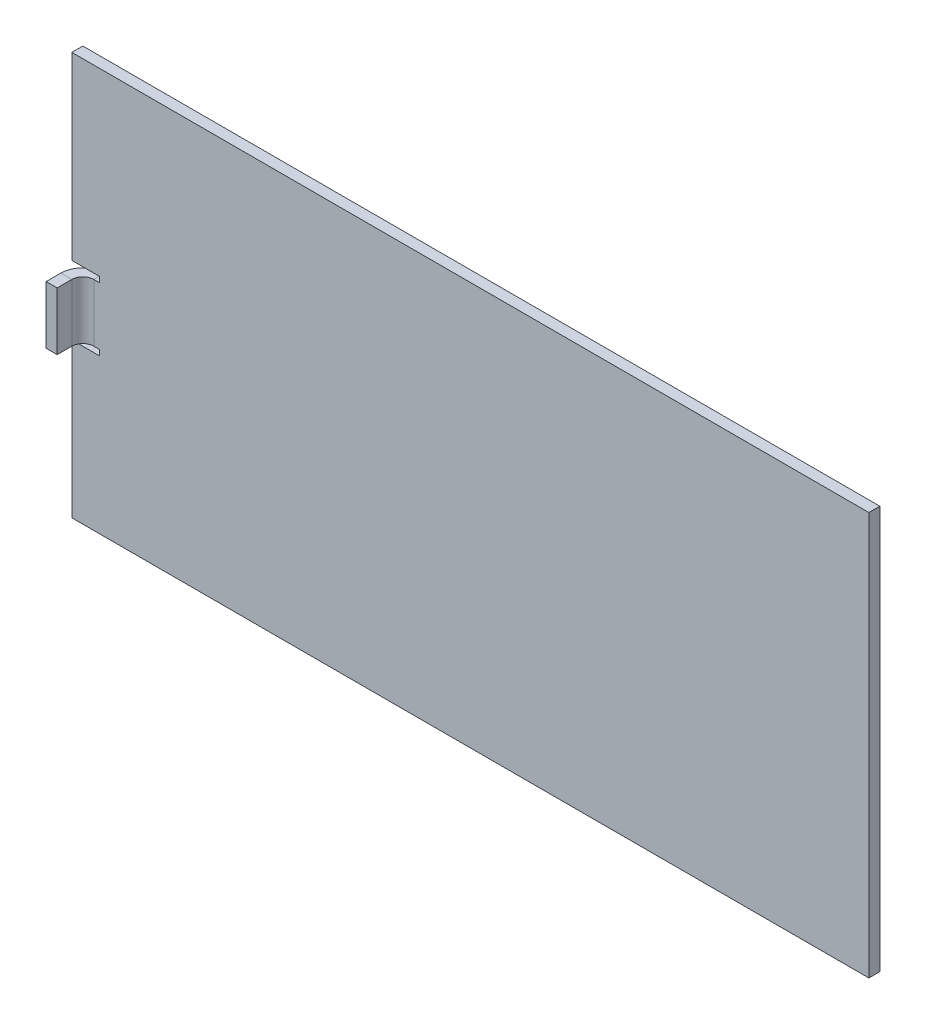
from build123d import *

# Parameters (mm, degrees)
SKETCH3_W                     = 43.5
SKETCH3_H                     = 22
BOSS_EXTRUDE3_DEPTH           = 0.6
EDGE_FLANGE1_STRIP_W          = 3.6
EDGE_FLANGE1_STRIP_H          = 0.6
EDGE_FLANGE1_STRIP_CUT_DEPTH  = 3.155767649
EDGE_FLANGE1_RELIEF_W         = 3.9
EDGE_FLANGE1_RELIEF_H         = 0.3
EDGE_FLANGE1_RELIEF_CUT_DEPTH = 0.6
EDGE_FLANGE1_DEPTH            = 3.155767649


# Sheet-metal steps are written as plain solids
with BuildPart() as part:
    # Sketch3 → Boss-Extrude3 (new body)
    with BuildSketch(Plane.XY):
        with Locations((21.75, 11)):
            Rectangle(SKETCH3_W, SKETCH3_H)
    extrude(amount=BOSS_EXTRUDE3_DEPTH)

    # Edge-Flange1 strip (across the edge) → Edge-Flange1 strip cut (cut)
    with BuildSketch(Plane(origin=(0, 11.866760766, 0.6), x_dir=(1, 0, 0), z_dir=(0, -1, 0))):
        with Locations((-0.6, -0.3)):
            Rectangle(EDGE_FLANGE1_STRIP_W, EDGE_FLANGE1_STRIP_H)
    extrude(amount=EDGE_FLANGE1_STRIP_CUT_DEPTH, mode=Mode.SUBTRACT)

    # Edge-Flange1 relief (on the sheet) → Edge-Flange1 relief cut (cut)
    with BuildSketch(Plane(origin=(1.2, 11.866760766, 0.6), x_dir=(1, 0, 0), z_dir=(0, 0, 1))):
        with Locations((-1.65, 0.15)):
            Rectangle(EDGE_FLANGE1_RELIEF_W, EDGE_FLANGE1_RELIEF_H)
        with Locations((-1.65, -3.305767649)):
            Rectangle(EDGE_FLANGE1_RELIEF_W, EDGE_FLANGE1_RELIEF_H)
    extrude(amount=-EDGE_FLANGE1_RELIEF_CUT_DEPTH, mode=Mode.SUBTRACT)

    # Edge-Flange1 section (across the edge) → Edge-Flange1 (add)
    with BuildSketch(Plane(origin=(0, 11.866760766, 0.6), x_dir=(1, 0, 0), z_dir=(0, -1, 0))):
        with BuildLine():
            Line((0, 0.6), (0, 1.4))
            Line((0, 1.4), (0.6, 1.4))
            Line((0.6, 1.4), (0.6, 0.6))
            ThreePointArc((0.6, 0.6), (0.775735931, 0.175735931), (1.2, 0))
            Line((1.2, 0), (1.2, -0.6))
            ThreePointArc((1.2, -0.6), (0.351471863, -0.248528137), (0, 0.6))
        make_face()
    extrude(amount=EDGE_FLANGE1_DEPTH)


solid = part.part
